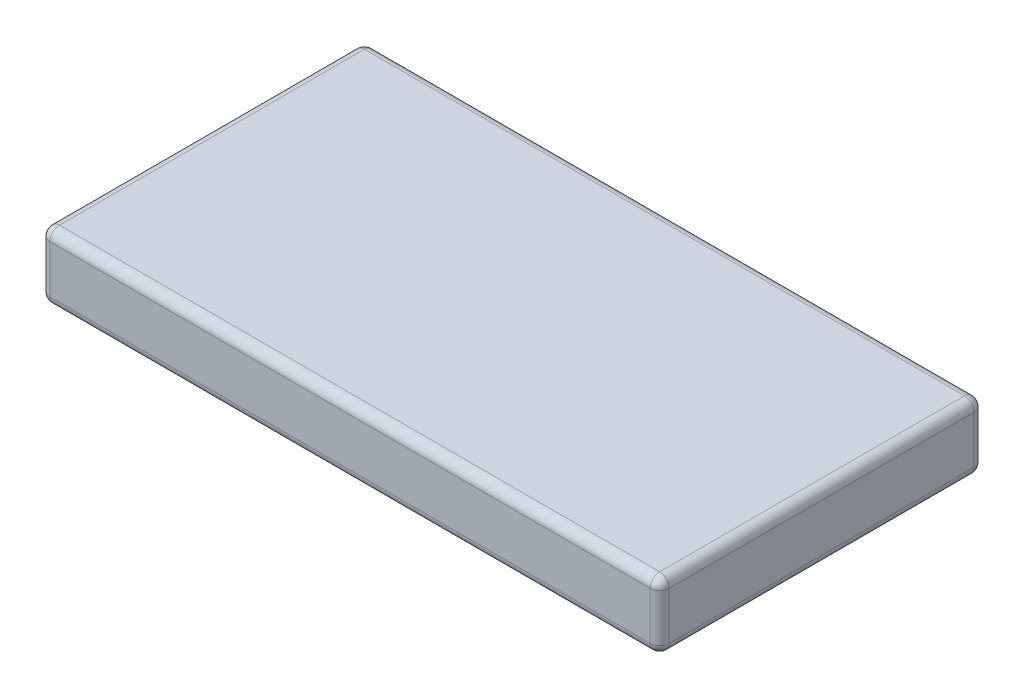
from build123d import *

# Parameters (mm, degrees)
SKETCH1_W           = 65
SKETCH1_H           = 34
BOSS_EXTRUDE1_DEPTH = 7
FILLET1_R           = 1


with BuildPart() as part:
    # Sketch1 → Boss-Extrude1 (new body)
    with BuildSketch(Plane(origin=(0, 0, 0), x_dir=(1, 0, 0), z_dir=(0, 1, 0))):
        Rectangle(SKETCH1_W, SKETCH1_H)
    extrude(amount=BOSS_EXTRUDE1_DEPTH)

    # Fillet1
    fillet1_edges = [part.edges().sort_by_distance(p)[0] for p in [
        (-32.5, 3.5, -17),
        (32.5, 3.5, -17),
        (-32.5, 7, 0),
        (0, 7, -17),
        (32.5, 7, 0),
        (-32.5, 3.5, 17),
        (0, 7, 17),
        (32.5, 3.5, 17),
        (0, 0, -17),
        (-32.5, 0, 0),
        (0, 0, 17),
        (32.5, 0, 0),
    ]]
    fillet(fillet1_edges, radius=FILLET1_R)


solid = part.part
